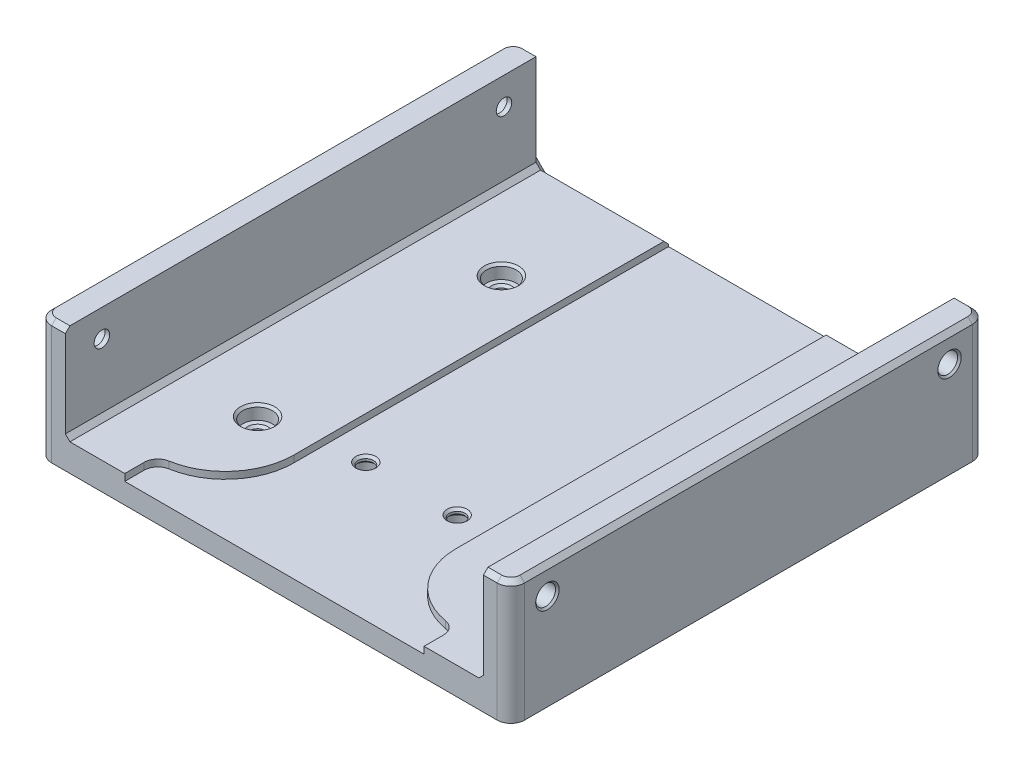
from build123d import *

# Parameters (mm, degrees)
SKETCH1_W                     = 6
SKETCH1_H                     = 21
BOSS_EXTRUDE1_DEPTH           = 104
SKETCH2_W                     = 35.5
SKETCH2_H                     = 1.5
CUT_EXTRUDE1_DEPTH            = 119.61729427
CBORE_FOR_M3_SHCS1_AT_2_COUNT = 2
CBORE_FOR_M3_SHCS1_AT_2_PITCH = 20
CBORE_FOR_M3_SHCS2_AT_2_COUNT = 2
CBORE_FOR_M3_SHCS2_AT_2_PITCH = 58
CBORE_FOR_M3_SHCS2_AT_3_COUNT = 2
CBORE_FOR_M3_SHCS2_AT_3_PITCH = 78.811735167
CBORE_FOR_M3_SHCS2_AT_4_COUNT = 2
CBORE_FOR_M3_SHCS2_AT_4_PITCH = 53.36
M3_CLEARANCE_HOLE1_D          = 3.4
SKETCH25_R                    = 2.165
CUT_EXTRUDE7_DEPTH            = 5
CUT_EXTRUDE8_START            = -5
SKETCH26_R                    = 2.165
CUT_EXTRUDE8_DEPTH            = 5
SKETCH28_W                    = 15
SKETCH28_H                    = 7
CUT_EXTRUDE10_DEPTH           = 1.5
FILLET3_R                     = 15
FILLET2_R                     = 3
CHAMFER1_SIZE                 = 1
CHAMFER2_SIZE                 = 0.4


with BuildPart() as part:
    # Sketch1 → Boss-Extrude1 (new body)
    with BuildSketch(Plane.XY):
        with Locations((-48.75, 13.5)):
            Rectangle(SKETCH1_W, SKETCH1_H)
        Polygon((-45.75, 3), (-51.75, 3), (-51.75, -3), (51.75, -3), (51.75, 3), (45.75, 3), align=None)
        with Locations((48.75, 13.5)):
            Rectangle(SKETCH1_W, SKETCH1_H)
    extrude(amount=-BOSS_EXTRUDE1_DEPTH)

    # Sketch2 → Cut-Extrude1 (cut, through all)
    with BuildSketch(Plane.XY):
        with Locations((0, 2.25)):
            Rectangle(SKETCH2_W, SKETCH2_H)
    extrude(amount=-CUT_EXTRUDE1_DEPTH, mode=Mode.SUBTRACT)

    # Sketch7 → CBORE for M3 SHCS1 (revolve, cut)
    with BuildSketch(Plane(origin=(-10, -3, -30), x_dir=(0, 0, -1), z_dir=(1, 0, 0))):
        Polygon((0, 0), (0, 4.5), (2.2, 4.5), (1.7, 4), (1.7, 3.5), (2.2, 3), (3.25, 3), (3.25, 0.5), (3.75, 0), align=None)
    cbore_for_m3_shcs1 = revolve(axis=Axis((-10, -9.35, -30), (0, 1, 0)), mode=Mode.SUBTRACT)

    # CBORE for M3 SHCS1 at 2: CBORE for M3 SHCS1 ×2
    with Locations(*[(i * CBORE_FOR_M3_SHCS1_AT_2_PITCH, 0, 0) for i in range(1, CBORE_FOR_M3_SHCS1_AT_2_COUNT)]):
        add(cbore_for_m3_shcs1, mode=Mode.SUBTRACT)

    # Sketch19 → CBORE for M3 SHCS2 (revolve, cut)
    with BuildSketch(Plane(origin=(-29, 3, -25.32), x_dir=(0, 0, 1), z_dir=(1, 0, 0))):
        Polygon((0, 0), (0, 6), (2.2, 6), (1.7, 5.5), (1.7, 3.5), (2.2, 3), (3.25, 3), (3.25, 0.5), (3.75, 0), align=None)
    cbore_for_m3_shcs2 = revolve(axis=Axis((-29, 9.35, -25.32), (0, -1, 0)), mode=Mode.SUBTRACT)

    # CBORE for M3 SHCS2 at 2: CBORE for M3 SHCS2 ×2
    with Locations(*[(i * CBORE_FOR_M3_SHCS2_AT_2_PITCH, 0, 0) for i in range(1, CBORE_FOR_M3_SHCS2_AT_2_COUNT)]):
        add(cbore_for_m3_shcs2, mode=Mode.SUBTRACT)

    # CBORE for M3 SHCS2 at 3: CBORE for M3 SHCS2 ×2
    with Locations(*[Vector(0.7359310117618296, 0, -0.6770565308208834) * (i * CBORE_FOR_M3_SHCS2_AT_3_PITCH) for i in range(1, CBORE_FOR_M3_SHCS2_AT_3_COUNT)]):
        add(cbore_for_m3_shcs2, mode=Mode.SUBTRACT)

    # CBORE for M3 SHCS2 at 4: CBORE for M3 SHCS2 ×2
    with Locations(*[(0, 0, -i * CBORE_FOR_M3_SHCS2_AT_4_PITCH) for i in range(1, CBORE_FOR_M3_SHCS2_AT_4_COUNT)]):
        add(cbore_for_m3_shcs2, mode=Mode.SUBTRACT)

    # M3 Clearance Hole1 (through all)
    with Locations(Plane.ZY.offset(51.75)):
        with Locations((-96, 18), (-8, 18)):
            Hole(M3_CLEARANCE_HOLE1_D / 2)

    # Sketch25 → Cut-Extrude7 (cut)
    with BuildSketch(Plane.ZY.offset(51.75)):
        with Locations((-96, 18)):
            Circle(SKETCH25_R)
        with Locations((-8, 18)):
            Circle(SKETCH25_R)
    extrude(amount=-CUT_EXTRUDE7_DEPTH, mode=Mode.SUBTRACT)

    # Sketch26 → Cut-Extrude8 (cut)
    with BuildSketch(Plane(origin=(51.75, 0, 0), x_dir=(0, 0, -1), z_dir=(1, 0, 0)).offset(CUT_EXTRUDE8_START)):
        with Locations(Location((8, 18, 0), (0, 0, 180))):
            Circle(SKETCH26_R)
        with Locations(Location((96, 18, 0), (0, 0, 180))):
            Circle(SKETCH26_R)
    extrude(amount=CUT_EXTRUDE8_DEPTH, mode=Mode.SUBTRACT)

    # Sketch28 → Cut-Extrude10 (cut)
    with BuildSketch(Plane(origin=(0, 3, 0), x_dir=(1, 0, 0), z_dir=(0, 1, 0))):
        with Locations((-25.25, 3.5)):
            Rectangle(SKETCH28_W, SKETCH28_H)
        with Locations((25.25, 3.5)):
            Rectangle(SKETCH28_W, SKETCH28_H)
    extrude(amount=-CUT_EXTRUDE10_DEPTH, mode=Mode.SUBTRACT)

    # Fillet3
    fillet3_edges = [part.edges().sort_by_distance(p)[0] for p in [
        (17.75, 2.25, -7),
        (-17.75, 2.25, -7),
    ]]
    fillet(fillet3_edges, radius=FILLET3_R - 0.0001)  # a hair under: the kernel refuses the full size

    # Fillet2
    fillet2_edges = [part.edges().sort_by_distance(p)[0] for p in [
        (-51.75, 10.5, -104),
        (-32.75, 2.25, -7),
        (32.75, 2.25, -7),
        (51.75, 10.5, -104),
        (51.75, 10.5, 0),
        (-51.75, 10.5, 0),
    ]]
    fillet(fillet2_edges, radius=FILLET2_R)

    # Chamfer1
    chamfer1_edges = [part.edges().sort_by_distance(p)[0] for p in [
        (45.75, 3, -52),
        (-31.75, 3, -104),
        (47.25, 24, -104),
        (-47.25, 24, -104),
        (-47.25, 24, 0),
        (-51.75, 24, -52),
        (-50.871320344, 24, -0.878679656),
        (-50.871320344, 24, -103.121320344),
        (51.75, 24, -52),
        (47.25, 24, 0),
        (50.871320344, 24, -0.878679656),
        (50.871320344, 24, -103.121320344),
        (45.75, 13.5, -104),
        (31.75, 3, -104),
        (-45.75, 3, -52),
        (-45.75, 13.5, -104),
    ]]
    chamfer(chamfer1_edges, length=CHAMFER1_SIZE)

    # Chamfer2
    chamfer2_edges = [part.edges().sort_by_distance(p)[0] for p in [
        (-51.75, 18, -98.165),
        (-51.75, 18, -10.165),
        (51.75, 18, -10.165),
        (51.75, 18, -98.165),
    ]]
    chamfer(chamfer2_edges, length=CHAMFER2_SIZE)


solid = part.part
